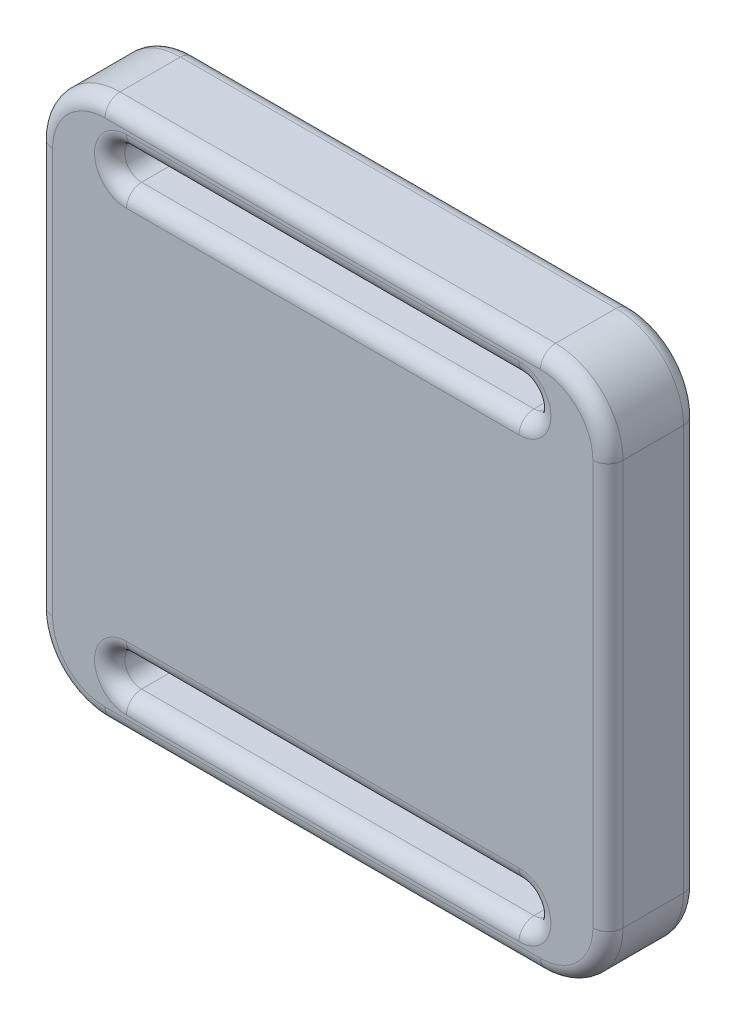
from build123d import *

# Parameters (mm, degrees)
BOSS_EXTRUDE1_DEPTH = 6
SKETCH2_W           = 34
SKETCH2_H           = 21
CUT_EXTRUDE1_DEPTH  = 5.5
FILLET1_R           = 1
CUT_EXTRUDE2_DEPTH  = 1
FILLET2_R           = 0.5


with BuildPart() as part:
    # Sketch1 → Boss-Extrude1 (new body)
    with BuildSketch(Plane(origin=(0, 0, 0.6), x_dir=(-1, 0, 0), z_dir=(0, 0, -1))):
        with BuildLine():
            Line((-4.473372781, 35.786982249), (-33.326627219, 35.786982249))
            ThreePointArc((-33.326627219, 35.786982249), (-36.489779447, 34.476761696), (-37.8, 31.313609467))
            Line((-37.8, 31.313609467), (-37.8, 4.473372781))
            ThreePointArc((-37.8, 4.473372781), (-36.489779447, 1.310220553), (-33.326627219, 0))
            Line((-33.326627219, 0), (-4.473372781, 0))
            ThreePointArc((-4.473372781, 0), (-1.310220553, 1.310220553), (0, 4.473372781))
            Line((0, 4.473372781), (0, 31.313609467))
            ThreePointArc((0, 31.313609467), (-1.310220553, 34.476761696), (-4.473372781, 35.786982249))
        make_face()
        with BuildLine():
            Line((-5.9, 4.473372781), (-31.9, 4.473372781))
            ThreePointArc((-31.9, 4.473372781), (-33.018343195, 3.355029586), (-31.9, 2.236686391))
            Line((-31.9, 2.236686391), (-5.9, 2.236686391))
            ThreePointArc((-5.9, 2.236686391), (-4.781656805, 3.355029586), (-5.9, 4.473372781))
        make_face(mode=Mode.SUBTRACT)
        with BuildLine():
            Line((-5.9, 31.31385603), (-31.9, 31.31385603))
            ThreePointArc((-31.9, 31.31385603), (-33.018343195, 32.432199225), (-31.9, 33.550542421))
            Line((-31.9, 33.550542421), (-5.9, 33.550542421))
            ThreePointArc((-5.9, 33.550542421), (-4.781656805, 32.432199225), (-5.9, 31.31385603))
        make_face(mode=Mode.SUBTRACT)
    extrude(amount=-BOSS_EXTRUDE1_DEPTH)

    # Sketch2 → Cut-Extrude1 (cut)
    with BuildSketch(Plane(origin=(0, 0, 0.6), x_dir=(-1, 0, 0), z_dir=(0, 0, -1))):
        with Locations((-18.9, 17.893491124)):
            Rectangle(SKETCH2_W, SKETCH2_H)
    extrude(amount=-CUT_EXTRUDE1_DEPTH, mode=Mode.SUBTRACT)

    # Fillet1
    fillet1_edges = [part.edges().sort_by_distance(p)[0] for p in [
        (36.489779447, 34.476761696, 6.6),
        (18.9, 35.786982249, 0.6),
        (1.310220553, 34.476761696, 0.6),
        (37.8, 17.893491124, 6.6),
        (36.489779447, 1.310220553, 6.6),
        (18.9, 0, 6.6),
        (1.310220553, 1.310220553, 6.6),
        (4.781656805, 3.355029586, 6.6),
        (18.9, 2.236686391, 6.6),
        (33.018343195, 3.355029586, 6.6),
        (18.9, 4.473372781, 6.6),
        (0, 17.893491124, 6.6),
        (4.781656805, 3.355029586, 0.6),
        (18.9, 4.473372781, 0.6),
        (33.018343195, 3.355029586, 0.6),
        (18.9, 2.236686391, 0.6),
        (4.781656805, 32.432199225, 6.6),
        (18.9, 31.31385603, 6.6),
        (33.018343195, 32.432199225, 6.6),
        (18.9, 33.550542421, 6.6),
        (4.781656805, 32.432199225, 0.6),
        (18.9, 33.550542421, 0.6),
        (33.018343195, 32.432199225, 0.6),
        (18.9, 31.31385603, 0.6),
        (1.310220553, 34.476761696, 6.6),
        (18.9, 35.786982249, 6.6),
        (0, 17.893491124, 0.6),
        (1.310220553, 1.310220553, 0.6),
        (18.9, 0, 0.6),
        (36.489779447, 1.310220553, 0.6),
        (37.8, 17.893491124, 0.6),
        (36.489779447, 34.476761696, 0.6),
    ]]
    fillet(fillet1_edges, radius=FILLET1_R)

    # Sketch3 → Cut-Extrude2 (cut)
    with BuildSketch(Plane(origin=(0, 0, 0.6), x_dir=(-1, 0, 0), z_dir=(0, 0, -1))):
        Polygon((-1.9, 28.393491124), (-4.781656805, 32.432199225), (-5.9, 31.31385603), (-3.816291747, 28.393491124), align=None)
    extrude(amount=-CUT_EXTRUDE2_DEPTH, mode=Mode.SUBTRACT)

    # Fillet2
    # the kernel refuses this fillet: 0.5 mm, written as the material it takes off along each edge
    with BuildSketch(Plane(origin=(5.066291747, 28.393491124, 1.6), x_dir=(0, 0, 1), z_dir=(-1, 0, 0))) as fillet2_piece_1_section:
        with BuildLine():
            CenterArc((FILLET2_R, FILLET2_R), FILLET2_R, 180, 90)
            Line((0, FILLET2_R), (0, 0))
            Line((0, 0), (FILLET2_R, 0))
        make_face()
    fillet2_piece_1 = extrude(amount=4.416291747, mode=Mode.PRIVATE)
    fillet2_piece_1 = split(fillet2_piece_1, bisect_by=Plane(origin=(2.302919603, 28.958192189, 1.711683969), z_dir=(0.8140321982584601, -0.5808197484577287, 0)), keep=Keep.TOP, mode=Mode.PRIVATE)
    fillet2_piece_1 = split(fillet2_piece_1, bisect_by=Plane(origin=(3.572747301, 28.052157998, 1.711683969), z_dir=(-0.8140321982584605, 0.5808197484577283, 0)), keep=Keep.TOP, mode=Mode.PRIVATE)
    add(fillet2_piece_1, mode=Mode.SUBTRACT)
    with BuildSketch(Plane(origin=(5.9, 32.432199225, 1.6), x_dir=(-0.4373254221081723, 0.8993033276808826, 0), z_dir=(0.8993033276808826, 0.4373254221081723, 0))) as fillet2_piece_2_section:
        with BuildLine():
            CenterArc((1.118343195 + FILLET2_R, FILLET2_R), FILLET2_R, 180, 90)
            Line((1.118343195, FILLET2_R), (1.118343195, 0))
            Line((1.118343195, 0), (1.118343195 + FILLET2_R, 0))
        make_face()
    fillet2_piece_2 = revolve(axis=Axis((5.9, 32.432199225, 1.6), (0, 0, 1)), revolution_arc=218.133286673, mode=Mode.PRIVATE)
    fillet2_piece_2 = split(fillet2_piece_2, bisect_by=Plane(origin=(4.510634251, 32.0523549, 1.691521123), z_dir=(0.8140321982584601, -0.5808197484577287, 0)), keep=Keep.TOP, mode=Mode.PRIVATE)
    fillet2_piece_2 = split(fillet2_piece_2, bisect_by=Plane(origin=(5.780461948, 31.146320709, 1.691521123), z_dir=(-0.8140321982584605, 0.5808197484577283, 0)), keep=Keep.TOP, mode=Mode.PRIVATE)
    add(fillet2_piece_2, mode=Mode.SUBTRACT)


solid = part.part
